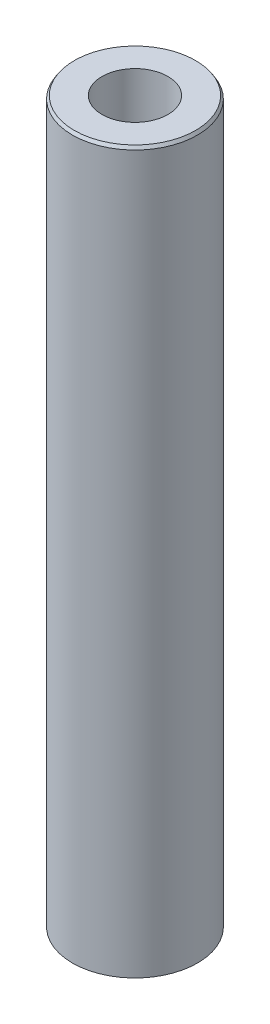
from build123d import *
from OCP.BRepFilletAPI import BRepFilletAPI_MakeChamfer

# Parameters (mm, degrees)
SKETCH1_R           = 40
BOSS_EXTRUDE1_DEPTH = 461.881009708
SKETCH2_R           = 21.099250832
CUT_EXTRUDE1_DEPTH  = 466.332211574
CHAMFER1_SIZE       = 1.954838265
CHAMFER1_SIZE2      = 1.223352604


with BuildPart() as part:
    # Sketch1 → Boss-Extrude1 (new body)
    with BuildSketch(Plane(origin=(0, 0, 0), x_dir=(1, 0, 0), z_dir=(0, 1, 0))):
        Circle(SKETCH1_R)
    extrude(amount=BOSS_EXTRUDE1_DEPTH)

    # Sketch2 → Cut-Extrude1 (cut, through all)
    with BuildSketch(Plane(origin=(0, 0, 0), x_dir=(1, 0, 0), z_dir=(0, 1, 0))):
        Circle(SKETCH2_R)
    extrude(amount=CUT_EXTRUDE1_DEPTH, mode=Mode.SUBTRACT)

    # Chamfer1: one chamfer whose edges measure the first distance from different faces: ONE call of the kernel's chamfer builder (chamfer() names one face for all edges)
    chamfer1_edges_1 = [part.edges().sort_by_distance(p)[0] for p in [
        (-40, 461.881009708, 0),
    ]]
    chamfer1_side_1 = [part.faces().sort_by_distance(p)[0] for p in [
        (-40, 230.940504854, 0),
    ]]
    chamfer1_edges_2 = [part.edges().sort_by_distance(p)[0] for p in [
        (-40, 0, 0),
    ]]
    chamfer1_side_2 = [part.faces().sort_by_distance(p)[0] for p in [
        (-38.86862915, 0, 0),
    ]]
    chamfer1 = BRepFilletAPI_MakeChamfer(part.part.solid().wrapped)
    for e in chamfer1_edges_1:
        chamfer1.Add(CHAMFER1_SIZE, CHAMFER1_SIZE2, e.wrapped, chamfer1_side_1[0].wrapped)  # the first distance lies on this face
    for e in chamfer1_edges_2:
        chamfer1.Add(CHAMFER1_SIZE, CHAMFER1_SIZE2, e.wrapped, chamfer1_side_2[0].wrapped)  # the first distance lies on this face
    add(Compound.cast(chamfer1.Shape()), mode=Mode.REPLACE)


solid = part.part
